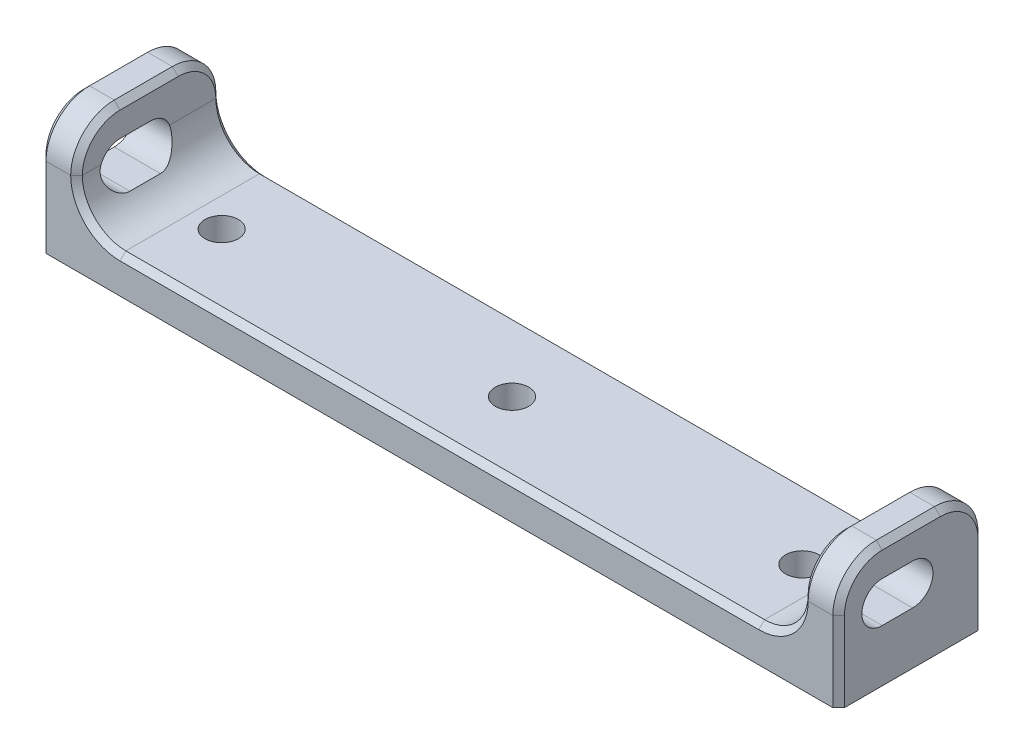
from build123d import *

# Parameters (mm, degrees)
BOSS_EXTRUDE1_DEPTH = 25.4
FILLET1_R           = 7.62
SKETCH2_R           = 2.921
CUT_EXTRUDE1_DEPTH  = 143.805838816
CHAMFER1_SIZE       = 1.016
CUT_EXTRUDE2_DEPTH  = 144.622345406


with BuildPart() as part:
    # Sketch1 → Boss-Extrude1 (new body)
    with BuildSketch(Plane.XY):
        Polygon((0, 0), (0, 21.59), (6.35, 21.59), (6.35, 6.35), (133.35, 6.35), (133.35, 21.59), (139.7, 21.59), (139.7, 0), align=None)
    extrude(amount=BOSS_EXTRUDE1_DEPTH)

    # Fillet1
    fillet1_edges = [part.edges().sort_by_distance(p)[0] for p in [
        (136.525, 21.59, 0),
        (136.525, 21.59, 25.4),
        (3.175, 21.59, 0),
        (3.175, 21.59, 25.4),
        (133.35, 6.35, 12.7),
        (6.35, 6.35, 12.7),
    ]]
    fillet(fillet1_edges, radius=FILLET1_R - 0.0001)  # a hair under: the kernel refuses the full size

    # Sketch2 → Cut-Extrude1 (cut, through all)
    with BuildSketch(Plane(origin=(0, 6.35, 0), x_dir=(1, 0, 0), z_dir=(0, 1, 0))):
        with Locations(Location((69.85, -12.7, 0), (0, 0, 270))):
            Circle(SKETCH2_R)
        with Locations(Location((120.65, -12.7, 0), (0, 0, 270))):
            Circle(SKETCH2_R)
        with Locations(Location((19.05, -12.7, 0), (0, 0, 270))):
            Circle(SKETCH2_R)
    extrude(amount=-CUT_EXTRUDE1_DEPTH, mode=Mode.SUBTRACT)

    # Chamfer1
    chamfer1_edges = [part.edges().sort_by_distance(p)[0] for p in [
        (139.7, 6.98505, 0),
        (133.35, 21.59, 12.7),
        (139.7, 21.59, 12.7),
        (133.35, 19.358182962, 23.168182962),
        (133.35, 19.358182962, 2.231817038),
        (0, 6.98505, 0),
        (69.85, 6.35, 0),
        (139.7, 19.358182962, 23.168182962),
        (139.7, 19.358182962, 2.231817038),
        (69.85, 6.35, 25.4),
        (0, 6.98505, 25.4),
        (0, 21.59, 12.7),
        (6.35, 21.59, 12.7),
        (0, 19.358182962, 23.168182962),
        (0, 19.358182962, 2.231817038),
        (6.35, 19.358182962, 23.168182962),
        (6.35, 19.358182962, 2.231817038),
        (131.118182962, 8.581817038, 0),
        (131.118182962, 8.581817038, 25.4),
        (8.581817038, 8.581817038, 0),
        (8.581817038, 8.581817038, 25.4),
        (139.7, 6.98505, 25.4),
    ]]
    chamfer(chamfer1_edges, length=CHAMFER1_SIZE)

    # Sketch3 → Cut-Extrude2 (cut, through all)
    with BuildSketch(Plane(origin=(139.7, 0, 0), x_dir=(0, 0, -1), z_dir=(1, 0, 0))):
        with BuildLine():
            Line((-17.78, 16.256), (-12.446, 16.256))
            ThreePointArc((-12.446, 16.256), (-8.89, 12.7), (-12.446, 9.144))
            Line((-12.446, 9.144), (-17.78, 9.144))
            ThreePointArc((-17.78, 9.144), (-21.336, 12.7), (-17.78, 16.256))
        make_face()
    extrude(amount=-CUT_EXTRUDE2_DEPTH, mode=Mode.SUBTRACT)


solid = part.part
